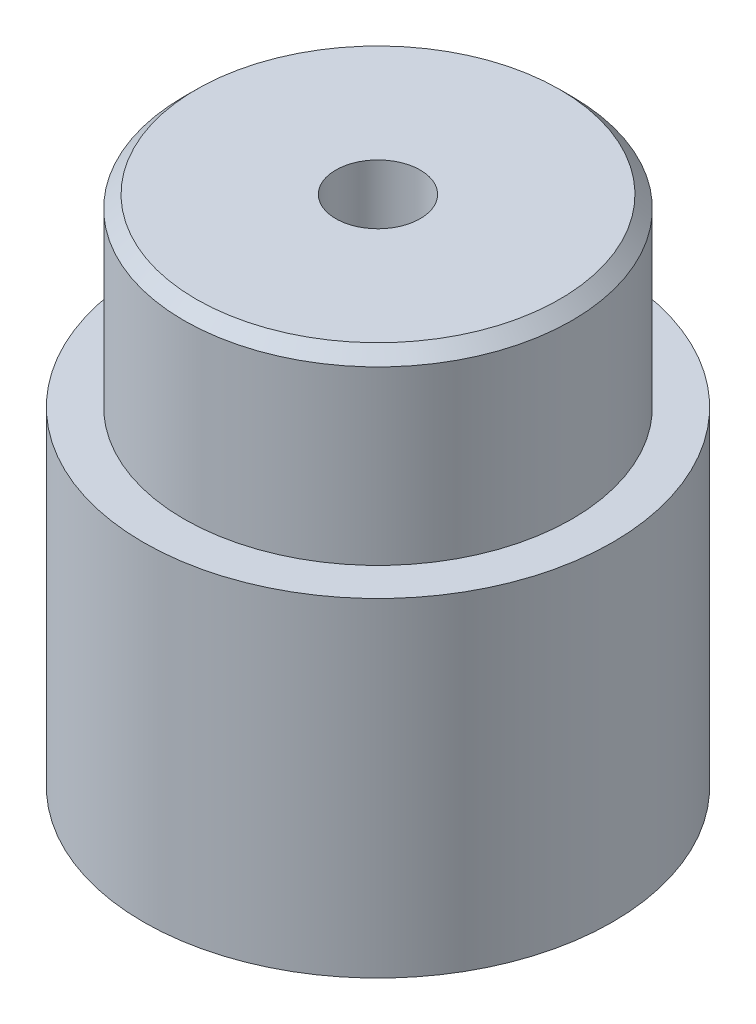
from build123d import *

# Parameters (mm, degrees)
SKETCH1_R                    = 24.257
BOSS_EXTRUDE1_DEPTH          = 34
SKETCH2_R                    = 20.066
BOSS_EXTRUDE2_DEPTH          = 19.05
CHAMFER1_SIZE                = 1.27
Y_0_404_DIAMETER_HOLE1_D     = 10.2616
Y_0_404_DIAMETER_HOLE1_DEPTH = 14.732
F_5_16_CLEARANCE_HOLE1_D     = 8.72998


with BuildPart() as part:
    # Sketch1 → Boss-Extrude1 (new body)
    with BuildSketch(Plane(origin=(0, 0, 0), x_dir=(1, 0, 0), z_dir=(0, 1, 0))):
        Circle(SKETCH1_R)
    extrude(amount=-BOSS_EXTRUDE1_DEPTH)

    # Sketch2 → Boss-Extrude2 (add)
    with BuildSketch(Plane(origin=(0, 0, 0), x_dir=(1, 0, 0), z_dir=(0, 1, 0))):
        Circle(SKETCH2_R)
    extrude(amount=BOSS_EXTRUDE2_DEPTH)

    # Chamfer1
    chamfer1_edges = [part.edges().sort_by_distance(p)[0] for p in [
        (-20.066, 19.05, 0),
    ]]
    chamfer(chamfer1_edges, length=CHAMFER1_SIZE)

    # Y (0.404) Diameter Hole1
    with Locations(Plane(origin=(0, -34, 0), x_dir=(-1, 0, 0), z_dir=(0, -1, 0))):
        with Locations((0, 0)):
            Hole(Y_0_404_DIAMETER_HOLE1_D / 2, depth=Y_0_404_DIAMETER_HOLE1_DEPTH)

    # 5/16 Clearance Hole1 (through all)
    with Locations(Plane(origin=(0, -19.268, 0), x_dir=(-1, 0, 0), z_dir=(0, -1, 0))):
        with Locations((0, 0)):
            Hole(F_5_16_CLEARANCE_HOLE1_D / 2)


solid = part.part
